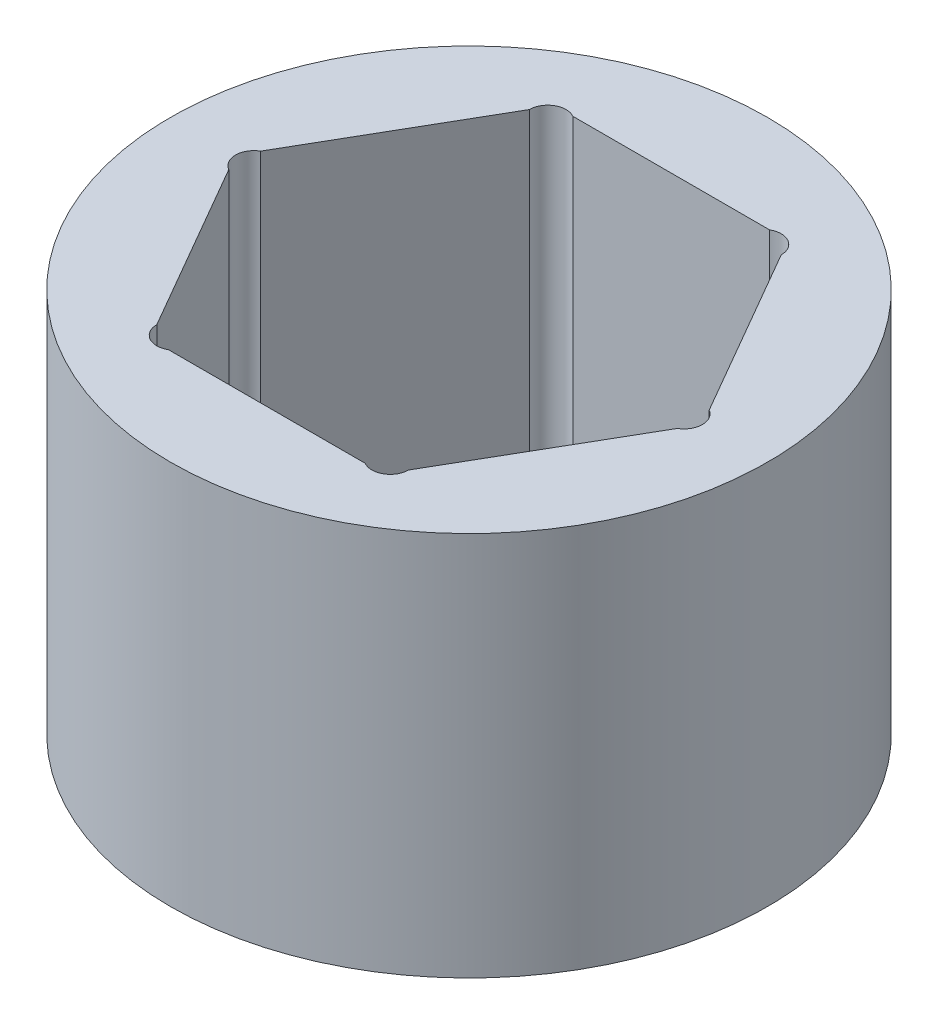
from build123d import *

# Parameters (mm, degrees)
SKETCH1_R           = 9.7536
BOSS_EXTRUDE1_DEPTH = 12.573


with BuildPart() as part:
    # Sketch1 → Boss-Extrude1 (new body)
    with BuildSketch(Plane(origin=(0, 0, 0), x_dir=(1, 0, 0), z_dir=(0, 1, 0))):
        Circle(SKETCH1_R)
        with BuildLine():
            ThreePointArc((3.812821178, 6.604), (4.03243642, 6.384384758), (4.112821178, 6.084384758))
            Line((4.112821178, 6.084384758), (7.325642355, 0.519615242))
            ThreePointArc((7.325642355, 0.519615242), (7.545257598, 0.3), (7.625642355, 0))
            ThreePointArc((7.625642355, 0), (7.545257598, -0.3), (7.325642355, -0.519615242))
            Line((7.325642355, -0.519615242), (4.112821178, -6.084384758))
            ThreePointArc((4.112821178, -6.084384758), (4.03243642, -6.384384758), (3.812821178, -6.604))
            ThreePointArc((3.812821178, -6.604), (3.512821178, -6.684384758), (3.212821178, -6.604))
            Line((3.212821178, -6.604), (-3.212821178, -6.604))
            ThreePointArc((-3.212821178, -6.604), (-3.512821178, -6.684384758), (-3.812821178, -6.604))
            ThreePointArc((-3.812821178, -6.604), (-4.03243642, -6.384384758), (-4.112821178, -6.084384758))
            Line((-4.112821178, -6.084384758), (-7.325642355, -0.519615242))
            ThreePointArc((-7.325642355, -0.519615242), (-7.545257598, -0.3), (-7.625642355, 0))
            ThreePointArc((-7.625642355, 0), (-7.545257598, 0.3), (-7.325642355, 0.519615242))
            Line((-7.325642355, 0.519615242), (-4.112821178, 6.084384758))
            ThreePointArc((-4.112821178, 6.084384758), (-4.03243642, 6.384384758), (-3.812821178, 6.604))
            ThreePointArc((-3.812821178, 6.604), (-3.512821178, 6.684384758), (-3.212821178, 6.604))
            Line((-3.212821178, 6.604), (3.212821178, 6.604))
            ThreePointArc((3.212821178, 6.604), (3.512821178, 6.684384758), (3.812821178, 6.604))
        make_face(mode=Mode.SUBTRACT)
    extrude(amount=BOSS_EXTRUDE1_DEPTH)


solid = part.part
